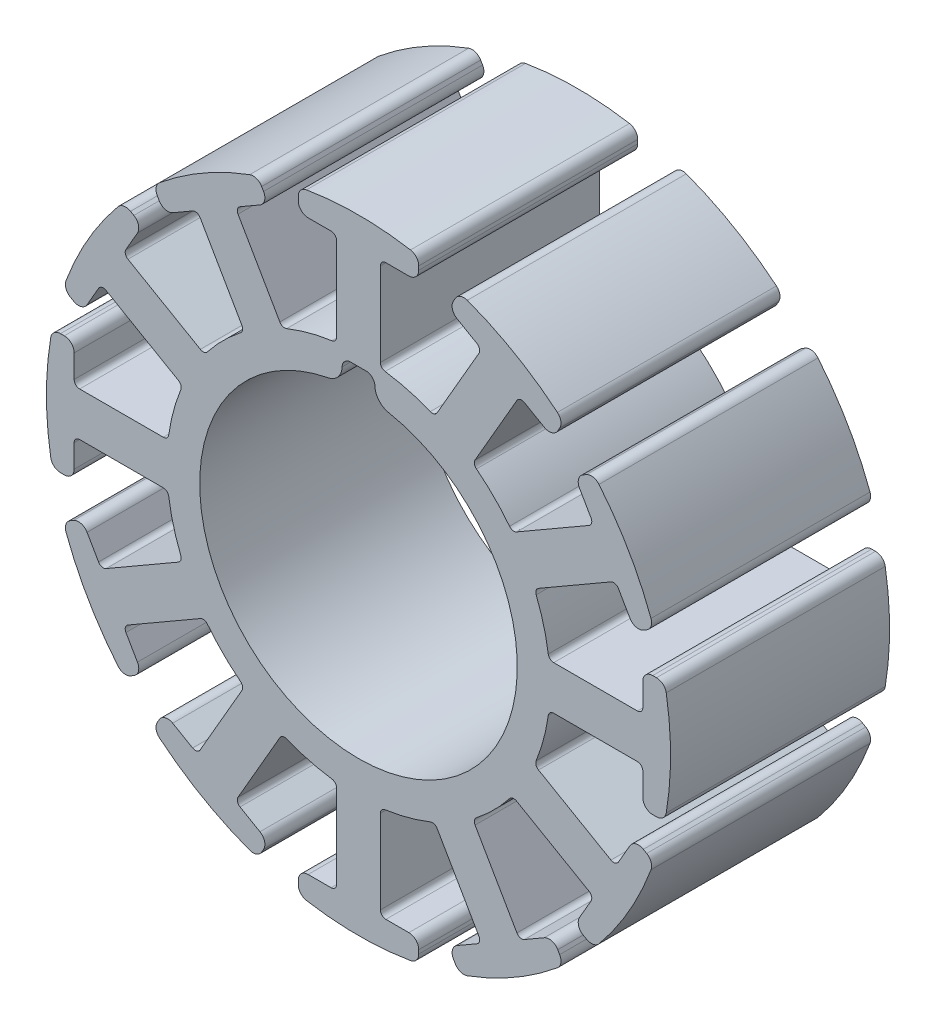
from build123d import *

# Parameters (mm, degrees)
SKETCH_1_R          = 14.5
EXTRUDE_1_DEPTH     = 20
FILLET_1_R          = 0.9
FILLET_2_R          = 0.9
FILLET_3_R          = 0.9
FILLET_4_R          = 0.9
FILLET_5_R          = 0.5
FILLET_6_R          = 0.5
SKETCH_3_W          = 3
SKETCH_3_H          = 4
CUT_EXTRUDE_1_DEPTH = 45.994444101
FILLET_7_R          = 1.55
FILLET_8_R          = 0.8


with BuildPart() as part:
    # ｽｹｯﾁ1 → ﾎﾞｽ - 押し出し1 (new body)
    with BuildSketch(Plane.XY):
        with BuildLine():
            Line((-2, 25.964262908), (-2, 17.385338651))
            ThreePointArc((-2, 17.385338651), (-4.529333289, 16.90370196), (-6.960618518, 16.056144925))
            Line((-6.960618518, 16.056144925), (-11.250080647, 23.485711269))
            Line((-11.250080647, 23.485711269), (-8.218991733, 25.235711269))
            Line((-8.218991733, 25.235711269), (-9.218991733, 26.967762077))
            ThreePointArc((-9.218991733, 26.967762077), (-14.25, 24.681724008), (-18.745271175, 21.467762077))
            Line((-18.745271175, 21.467762077), (-17.745271175, 19.735711269))
            Line((-17.745271175, 19.735711269), (-14.714182262, 21.485711269))
            Line((-14.714182262, 21.485711269), (-10.424720133, 14.056144925))
            ThreePointArc((-10.424720133, 14.056144925), (-12.374368671, 12.374368671), (-14.056144925, 10.424720133))
            Line((-14.056144925, 10.424720133), (-21.485711269, 14.714182262))
            Line((-21.485711269, 14.714182262), (-19.735711269, 17.745271175))
            Line((-19.735711269, 17.745271175), (-21.467762077, 18.745271175))
            ThreePointArc((-21.467762077, 18.745271175), (-24.681724008, 14.25), (-26.967762077, 9.218991733))
            Line((-26.967762077, 9.218991733), (-25.235711269, 8.218991733))
            Line((-25.235711269, 8.218991733), (-23.485711269, 11.250080647))
            Line((-23.485711269, 11.250080647), (-16.056144925, 6.960618518))
            ThreePointArc((-16.056144925, 6.960618518), (-16.90370196, 4.529333289), (-17.385338651, 2))
            Line((-17.385338651, 2), (-25.964262908, 2))
            Line((-25.964262908, 2), (-25.964262908, 5.5))
            Line((-25.964262908, 5.5), (-27.964262908, 5.5))
            ThreePointArc((-27.964262908, 5.5), (-28.5, 0), (-27.964262908, -5.5))
            Line((-27.964262908, -5.5), (-25.964262908, -5.5))
            Line((-25.964262908, -5.5), (-25.964262908, -2))
            Line((-25.964262908, -2), (-17.385338651, -2))
            ThreePointArc((-17.385338651, -2), (-16.90370196, -4.529333289), (-16.056144925, -6.960618518))
            Line((-16.056144925, -6.960618518), (-23.485711269, -11.250080647))
            Line((-23.485711269, -11.250080647), (-25.235711269, -8.218991733))
            Line((-25.235711269, -8.218991733), (-26.967762077, -9.218991733))
            ThreePointArc((-26.967762077, -9.218991733), (-24.681724008, -14.25), (-21.467762077, -18.745271175))
            Line((-21.467762077, -18.745271175), (-19.735711269, -17.745271175))
            Line((-19.735711269, -17.745271175), (-21.485711269, -14.714182262))
            Line((-21.485711269, -14.714182262), (-14.056144925, -10.424720133))
            ThreePointArc((-14.056144925, -10.424720133), (-12.374368671, -12.374368671), (-10.424720133, -14.056144925))
            Line((-10.424720133, -14.056144925), (-14.714182262, -21.485711269))
            Line((-14.714182262, -21.485711269), (-17.745271175, -19.735711269))
            Line((-17.745271175, -19.735711269), (-18.745271175, -21.467762077))
            ThreePointArc((-18.745271175, -21.467762077), (-14.25, -24.681724008), (-9.218991733, -26.967762077))
            Line((-9.218991733, -26.967762077), (-8.218991733, -25.235711269))
            Line((-8.218991733, -25.235711269), (-11.250080647, -23.485711269))
            Line((-11.250080647, -23.485711269), (-6.960618518, -16.056144925))
            ThreePointArc((-6.960618518, -16.056144925), (-4.529333289, -16.90370196), (-2, -17.385338651))
            Line((-2, -17.385338651), (-2, -25.964262908))
            Line((-2, -25.964262908), (-5.5, -25.964262908))
            Line((-5.5, -25.964262908), (-5.5, -27.964262908))
            ThreePointArc((-5.5, -27.964262908), (0, -28.5), (5.5, -27.964262908))
            Line((5.5, -27.964262908), (5.5, -25.964262908))
            Line((5.5, -25.964262908), (2, -25.964262908))
            Line((2, -25.964262908), (2, -17.385338651))
            ThreePointArc((2, -17.385338651), (4.529333289, -16.90370196), (6.960618518, -16.056144925))
            Line((6.960618518, -16.056144925), (11.250080647, -23.485711269))
            Line((11.250080647, -23.485711269), (8.218991733, -25.235711269))
            Line((8.218991733, -25.235711269), (9.218991733, -26.967762077))
            ThreePointArc((9.218991733, -26.967762077), (14.25, -24.681724008), (18.745271175, -21.467762077))
            Line((18.745271175, -21.467762077), (17.745271175, -19.735711269))
            Line((17.745271175, -19.735711269), (14.714182262, -21.485711269))
            Line((14.714182262, -21.485711269), (10.424720133, -14.056144925))
            ThreePointArc((10.424720133, -14.056144925), (12.374368671, -12.374368671), (14.056144925, -10.424720133))
            Line((14.056144925, -10.424720133), (21.485711269, -14.714182262))
            Line((21.485711269, -14.714182262), (19.735711269, -17.745271175))
            Line((19.735711269, -17.745271175), (21.467762077, -18.745271175))
            ThreePointArc((21.467762077, -18.745271175), (24.681724008, -14.25), (26.967762077, -9.218991733))
            Line((26.967762077, -9.218991733), (25.235711269, -8.218991733))
            Line((25.235711269, -8.218991733), (23.485711269, -11.250080647))
            Line((23.485711269, -11.250080647), (16.056144925, -6.960618518))
            ThreePointArc((16.056144925, -6.960618518), (16.90370196, -4.529333289), (17.385338651, -2))
            Line((17.385338651, -2), (25.964262908, -2))
            Line((25.964262908, -2), (25.964262908, -5.5))
            Line((25.964262908, -5.5), (27.964262908, -5.5))
            ThreePointArc((27.964262908, -5.5), (28.5, 0), (27.964262908, 5.5))
            Line((27.964262908, 5.5), (25.964262908, 5.5))
            Line((25.964262908, 5.5), (25.964262908, 2))
            Line((25.964262908, 2), (17.385338651, 2))
            ThreePointArc((17.385338651, 2), (16.90370196, 4.529333289), (16.056144925, 6.960618518))
            Line((16.056144925, 6.960618518), (23.485711269, 11.250080647))
            Line((23.485711269, 11.250080647), (25.235711269, 8.218991733))
            Line((25.235711269, 8.218991733), (26.967762077, 9.218991733))
            ThreePointArc((26.967762077, 9.218991733), (24.681724008, 14.25), (21.467762077, 18.745271175))
            Line((21.467762077, 18.745271175), (19.735711269, 17.745271175))
            Line((19.735711269, 17.745271175), (21.485711269, 14.714182262))
            Line((21.485711269, 14.714182262), (14.056144925, 10.424720133))
            ThreePointArc((14.056144925, 10.424720133), (12.374368671, 12.374368671), (10.424720133, 14.056144925))
            Line((10.424720133, 14.056144925), (14.714182262, 21.485711269))
            Line((14.714182262, 21.485711269), (17.745271175, 19.735711269))
            Line((17.745271175, 19.735711269), (18.745271175, 21.467762077))
            ThreePointArc((18.745271175, 21.467762077), (14.25, 24.681724008), (9.218991733, 26.967762077))
            Line((9.218991733, 26.967762077), (8.218991733, 25.235711269))
            Line((8.218991733, 25.235711269), (11.250080647, 23.485711269))
            Line((11.250080647, 23.485711269), (6.960618518, 16.056144925))
            ThreePointArc((6.960618518, 16.056144925), (4.529333289, 16.90370196), (2, 17.385338651))
            Line((2, 17.385338651), (2, 25.964262908))
            Line((2, 25.964262908), (5.5, 25.964262908))
            Line((5.5, 25.964262908), (5.5, 27.964262908))
            ThreePointArc((5.5, 27.964262908), (0, 28.5), (-5.5, 27.964262908))
            Line((-5.5, 27.964262908), (-5.5, 25.964262908))
            Line((-5.5, 25.964262908), (-2, 25.964262908))
        make_face()
        Circle(SKETCH_1_R, mode=Mode.SUBTRACT)
    extrude(amount=EXTRUDE_1_DEPTH)

    # ﾌｨﾚｯﾄ1
    fillet_1_edges = [part.edges().sort_by_distance(p)[0] for p in [
        (-17.745271175, 19.735711269, 10),
        (-18.745271175, 21.467762077, 10),
        (-9.218991733, 26.967762077, 10),
        (-8.218991733, 25.235711269, 10),
    ]]
    fillet(fillet_1_edges, radius=FILLET_1_R)

    # ﾌｨﾚｯﾄ2
    fillet_2_edges = [part.edges().sort_by_distance(p)[0] for p in [
        (25.235711269, 8.218991733, 10),
        (17.745271175, 19.735711269, 10),
        (19.735711269, 17.745271175, 10),
        (26.967762077, 9.218991733, 10),
        (5.5, 25.964262908, 10),
        (21.467762077, 18.745271175, 10),
        (18.745271175, 21.467762077, 10),
        (8.218991733, 25.235711269, 10),
        (9.218991733, 26.967762077, 10),
        (5.5, 27.964262908, 10),
        (-5.5, 25.964262908, 10),
        (-5.5, 27.964262908, 10),
    ]]
    fillet(fillet_2_edges, radius=FILLET_2_R)

    # ﾌｨﾚｯﾄ3
    fillet_3_edges = [part.edges().sort_by_distance(p)[0] for p in [
        (21.467762077, -18.745271175, 10),
        (19.735711269, -17.745271175, 10),
        (26.967762077, -9.218991733, 10),
        (25.235711269, -8.218991733, 10),
        (25.964262908, 5.5, 10),
        (25.964262908, -5.5, 10),
        (27.964262908, -5.5, 10),
        (27.964262908, 5.5, 10),
    ]]
    fillet(fillet_3_edges, radius=FILLET_3_R)

    # ﾌｨﾚｯﾄ4
    fillet_4_edges = [part.edges().sort_by_distance(p)[0] for p in [
        (-21.467762077, 18.745271175, 10),
        (-19.735711269, 17.745271175, 10),
        (-26.967762077, 9.218991733, 10),
        (-25.235711269, 8.218991733, 10),
        (-25.964262908, 5.5, 10),
        (-27.964262908, 5.5, 10),
        (-25.964262908, -5.5, 10),
        (-27.964262908, -5.5, 10),
        (-25.235711269, -8.218991733, 10),
        (-26.967762077, -9.218991733, 10),
        (-21.467762077, -18.745271175, 10),
        (-19.735711269, -17.745271175, 10),
        (-17.745271175, -19.735711269, 10),
        (-18.745271175, -21.467762077, 10),
        (-9.218991733, -26.967762077, 10),
        (-8.218991733, -25.235711269, 10),
        (-5.5, -25.964262908, 10),
        (-5.5, -27.964262908, 10),
        (5.5, -25.964262908, 10),
        (5.5, -27.964262908, 10),
        (9.218991733, -26.967762077, 10),
        (8.218991733, -25.235711269, 10),
        (18.745271175, -21.467762077, 10),
        (17.745271175, -19.735711269, 10),
    ]]
    fillet(fillet_4_edges, radius=FILLET_4_R)

    # ﾌｨﾚｯﾄ5
    fillet_5_edges = [part.edges().sort_by_distance(p)[0] for p in [
        (-23.485711269, -11.250080647, 10),
        (-16.056144925, -6.960618518, 10),
        (-21.485711269, -14.714182262, 10),
        (-14.056144925, -10.424720133, 10),
        (-14.714182262, -21.485711269, 10),
        (-10.424720133, -14.056144925, 10),
        (-11.250080647, -23.485711269, 10),
        (-6.960618518, -16.056144925, 10),
        (-2, -25.964262908, 10),
        (-2, -17.385338651, 10),
        (2, -25.964262908, 10),
        (2, -17.385338651, 10),
        (6.960618518, -16.056144925, 10),
        (11.250080647, -23.485711269, 10),
        (14.714182262, -21.485711269, 10),
        (10.424720133, -14.056144925, 10),
        (21.485711269, -14.714182262, 10),
        (14.056144925, -10.424720133, 10),
        (23.485711269, -11.250080647, 10),
        (16.056144925, -6.960618518, 10),
        (17.385338651, -2, 10),
        (25.964262908, -2, 10),
        (25.964262908, 2, 10),
        (17.385338651, 2, 10),
        (16.056144925, 6.960618518, 10),
        (23.485711269, 11.250080647, 10),
    ]]
    fillet(fillet_5_edges, radius=FILLET_5_R)

    # ﾌｨﾚｯﾄ6
    fillet_6_edges = [part.edges().sort_by_distance(p)[0] for p in [
        (21.485711269, 14.714182262, 10),
        (14.056144925, 10.424720133, 10),
        (10.424720133, 14.056144925, 10),
        (14.714182262, 21.485711269, 10),
        (11.250080647, 23.485711269, 10),
        (6.960618518, 16.056144925, 10),
        (-2, 17.385338651, 10),
        (-2, 25.964262908, 10),
        (2, 25.964262908, 10),
        (-11.250080647, 23.485711269, 10),
        (-10.424720133, 14.056144925, 10),
        (-21.485711269, 14.714182262, 10),
        (-14.714182262, 21.485711269, 10),
        (-23.485711269, 11.250080647, 10),
        (-16.056144925, 6.960618518, 10),
        (2, 17.385338651, 10),
        (-6.960618518, 16.056144925, 10),
        (-14.056144925, 10.424720133, 10),
        (-25.964262908, 2, 10),
        (-17.385338651, 2, 10),
        (-25.964262908, -2, 10),
        (-17.385338651, -2, 10),
    ]]
    fillet(fillet_6_edges, radius=FILLET_6_R)

    # ｽｹｯﾁ3 → ｶｯﾄ - 押し出し1 (cut, through all)
    with BuildSketch(Plane.XY.offset(20)):
        with Locations((0, 14.5)):
            Rectangle(SKETCH_3_W, SKETCH_3_H)
    extrude(amount=-CUT_EXTRUDE_1_DEPTH, mode=Mode.SUBTRACT)

    # ﾌｨﾚｯﾄ7
    fillet_7_edges = [part.edges().sort_by_distance(p)[0] for p in [
        (1.5, 14.422205102, 10),
        (-1.5, 14.422205102, 10),
    ]]
    fillet(fillet_7_edges, radius=FILLET_7_R)

    # ﾌｨﾚｯﾄ8
    fillet_8_edges = [part.edges().sort_by_distance(p)[0] for p in [
        (1.5, 16.5, 10),
        (-1.5, 16.5, 10),
    ]]
    fillet(fillet_8_edges, radius=FILLET_8_R)


solid = part.part
